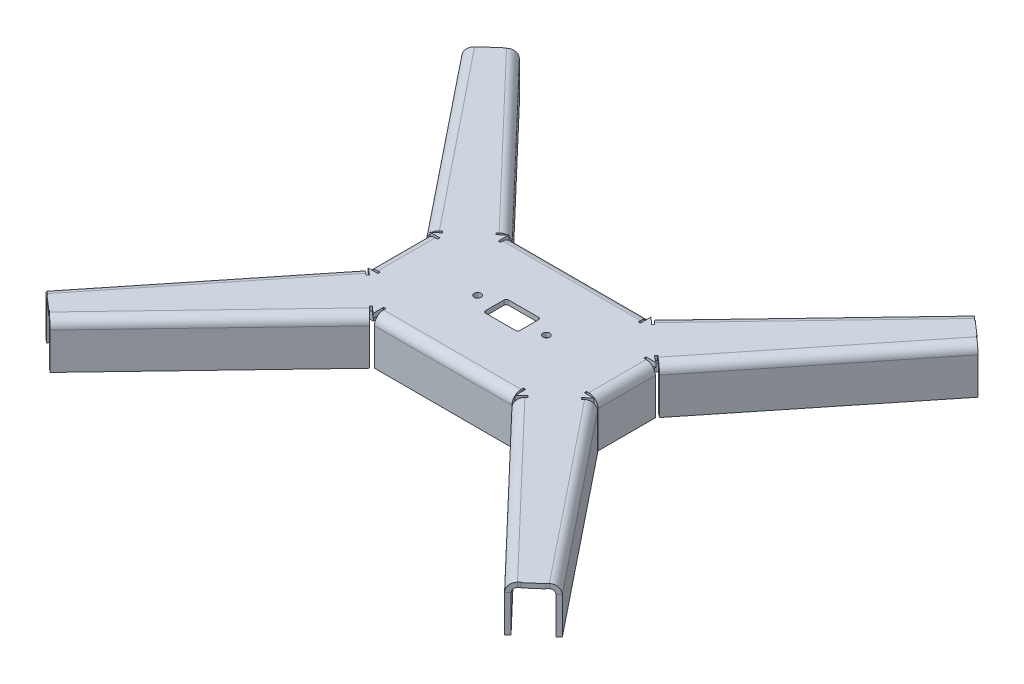
from build123d import *

# Parameters (mm, degrees)
BASE_FLANGE1_DEPTH             = 2
EDGE_FLANGE1_STRIP_W           = 12
EDGE_FLANGE1_STRIP_H           = 2
EDGE_FLANGE1_STRIP_CUT_DEPTH   = 60
EDGE_FLANGE1_RELIEF_W          = 13
EDGE_FLANGE1_RELIEF_H          = 1
EDGE_FLANGE1_RELIEF_CUT_DEPTH  = 2
EDGE_FLANGE1_DEPTH             = 60
EDGE_FLANGE2_STRIP_W           = 12
EDGE_FLANGE2_STRIP_H           = 2
EDGE_FLANGE2_STRIP_CUT_DEPTH   = 60
EDGE_FLANGE2_RELIEF_W          = 13
EDGE_FLANGE2_RELIEF_H          = 1
EDGE_FLANGE2_RELIEF_CUT_DEPTH  = 2
EDGE_FLANGE2_DEPTH             = 60
EDGE_FLANGE3_STRIP_W           = 12
EDGE_FLANGE3_STRIP_H           = 2
EDGE_FLANGE3_STRIP_CUT_DEPTH   = 25
EDGE_FLANGE3_RELIEF_W          = 13
EDGE_FLANGE3_RELIEF_H          = 1
EDGE_FLANGE3_RELIEF_CUT_DEPTH  = 2
EDGE_FLANGE3_DEPTH             = 25
EDGE_FLANGE4_STRIP_W           = 12
EDGE_FLANGE4_STRIP_H           = 2
EDGE_FLANGE4_STRIP_CUT_DEPTH   = 25
EDGE_FLANGE4_RELIEF_W          = 13
EDGE_FLANGE4_RELIEF_H          = 1
EDGE_FLANGE4_RELIEF_CUT_DEPTH  = 2
EDGE_FLANGE4_DEPTH             = 25
EDGE_FLANGE5_STRIP_W           = 12
EDGE_FLANGE5_STRIP_H           = 2
EDGE_FLANGE5_STRIP_CUT_DEPTH   = 98.814176372
EDGE_FLANGE5_RELIEF_W          = 13
EDGE_FLANGE5_RELIEF_H          = 1
EDGE_FLANGE5_RELIEF_CUT_DEPTH  = 2
EDGE_FLANGE5_DEPTH             = 98.814176372
EDGE_FLANGE6_STRIP_W           = 12
EDGE_FLANGE6_STRIP_H           = 2
EDGE_FLANGE6_STRIP_CUT_DEPTH   = 98.647471987
EDGE_FLANGE6_RELIEF_W          = 13
EDGE_FLANGE6_RELIEF_H          = 1
EDGE_FLANGE6_RELIEF_CUT_DEPTH  = 2
EDGE_FLANGE6_DEPTH             = 98.647471987
EDGE_FLANGE8_STRIP_W           = 12
EDGE_FLANGE8_STRIP_H           = 2
EDGE_FLANGE8_STRIP_CUT_DEPTH   = 98.814176372
EDGE_FLANGE8_RELIEF_W          = 13
EDGE_FLANGE8_RELIEF_H          = 1
EDGE_FLANGE8_RELIEF_CUT_DEPTH  = 2
EDGE_FLANGE8_DEPTH             = 98.814176372
EDGE_FLANGE9_STRIP_W           = 12
EDGE_FLANGE9_STRIP_H           = 2
EDGE_FLANGE9_STRIP_CUT_DEPTH   = 98.647471987
EDGE_FLANGE9_RELIEF_W          = 13
EDGE_FLANGE9_RELIEF_H          = 1
EDGE_FLANGE9_RELIEF_CUT_DEPTH  = 2
EDGE_FLANGE9_DEPTH             = 98.647471987
EDGE_FLANGE10_STRIP_W          = 12
EDGE_FLANGE10_STRIP_H          = 2
EDGE_FLANGE10_STRIP_CUT_DEPTH  = 98.647471987
EDGE_FLANGE10_RELIEF_W         = 13
EDGE_FLANGE10_RELIEF_H         = 1
EDGE_FLANGE10_RELIEF_CUT_DEPTH = 2
EDGE_FLANGE10_DEPTH            = 98.647471987
EDGE_FLANGE11_STRIP_W          = 12
EDGE_FLANGE11_STRIP_H          = 2
EDGE_FLANGE11_STRIP_CUT_DEPTH  = 98.814176372
EDGE_FLANGE11_RELIEF_W         = 13
EDGE_FLANGE11_RELIEF_H         = 1
EDGE_FLANGE11_RELIEF_CUT_DEPTH = 2
EDGE_FLANGE11_DEPTH            = 98.814176372
EDGE_FLANGE12_STRIP_W          = 12
EDGE_FLANGE12_STRIP_H          = 2
EDGE_FLANGE12_STRIP_CUT_DEPTH  = 98.814176372
EDGE_FLANGE12_RELIEF_W         = 13
EDGE_FLANGE12_RELIEF_H         = 1
EDGE_FLANGE12_RELIEF_CUT_DEPTH = 2
EDGE_FLANGE12_DEPTH            = 98.814176372
EDGE_FLANGE13_STRIP_W          = 12
EDGE_FLANGE13_STRIP_H          = 2
EDGE_FLANGE13_STRIP_CUT_DEPTH  = 98.647471987
EDGE_FLANGE13_RELIEF_W         = 13
EDGE_FLANGE13_RELIEF_H         = 1
EDGE_FLANGE13_RELIEF_CUT_DEPTH = 2
EDGE_FLANGE13_DEPTH            = 98.647471987
SKETCH58_R                     = 1.5
CUT_EXTRUDE2_DEPTH             = 154.469834479
SKETCH59_W                     = 15
SKETCH59_H                     = 10
CUT_EXTRUDE3_DEPTH             = 154.222028753
FILLET1_R                      = 1


# Sheet-metal steps are written as plain solids
with BuildPart() as part:
    # Sketch1 → Base-Flange1 (new body)
    with BuildSketch(Plane(origin=(0, 0, 0), x_dir=(1, 0, 0), z_dir=(0, 1, 0))):
        Polygon((-30, 30), (30, 30), (99.136281597, 102.382576262), (112.564639977, 90.63276268), (50, 12.5), (50, -12.5), (112.564639977, -90.63276268), (99.136281597, -102.382576262), (30, -30), (-30, -30), (-99.136281597, -102.382576262), (-112.564639977, -90.63276268), (-50, -12.5), (-50, 12.5), (-112.564639977, 90.63276268), (-99.136281597, 102.382576262), align=None)
    extrude(amount=-BASE_FLANGE1_DEPTH)

    # Edge-Flange1 strip (across the edge) → Edge-Flange1 strip cut (cut)
    with BuildSketch(Plane(origin=(30, -2, 30), x_dir=(0, 0, -1), z_dir=(-1, 0, 0))):
        with Locations((-2, -1)):
            Rectangle(EDGE_FLANGE1_STRIP_W, EDGE_FLANGE1_STRIP_H)
    extrude(amount=EDGE_FLANGE1_STRIP_CUT_DEPTH, mode=Mode.SUBTRACT)

    # Edge-Flange1 relief (on the sheet) → Edge-Flange1 relief cut (cut)
    with BuildSketch(Plane(origin=(30, -2, 26), x_dir=(0, 0, -1), z_dir=(0, -1, 0))):
        with Locations((-5.5, 0.5)):
            Rectangle(EDGE_FLANGE1_RELIEF_W, EDGE_FLANGE1_RELIEF_H)
        with Locations((-5.5, -60.5)):
            Rectangle(EDGE_FLANGE1_RELIEF_W, EDGE_FLANGE1_RELIEF_H)
    extrude(amount=-EDGE_FLANGE1_RELIEF_CUT_DEPTH, mode=Mode.SUBTRACT)

    # Edge-Flange1 section (across the edge) → Edge-Flange1 (add)
    with BuildSketch(Plane(origin=(30, -2, 30), x_dir=(0, 0, -1), z_dir=(-1, 0, 0))):
        with BuildLine():
            Line((0, 2), (0, 18))
            Line((0, 18), (2, 18))
            Line((2, 18), (2, 2))
            ThreePointArc((2, 2), (2.585786438, 0.585786438), (4, 0))
            Line((4, 0), (4, -2))
            ThreePointArc((4, -2), (1.171572875, -0.828427125), (0, 2))
        make_face()
    extrude(amount=EDGE_FLANGE1_DEPTH)

    # Edge-Flange2 strip (across the edge) → Edge-Flange2 strip cut (cut)
    with BuildSketch(Plane(origin=(-30, -2, -30), x_dir=(0, 0, 1), z_dir=(1, 0, 0))):
        with Locations((-2, -1)):
            Rectangle(EDGE_FLANGE2_STRIP_W, EDGE_FLANGE2_STRIP_H)
    extrude(amount=EDGE_FLANGE2_STRIP_CUT_DEPTH, mode=Mode.SUBTRACT)

    # Edge-Flange2 relief (on the sheet) → Edge-Flange2 relief cut (cut)
    with BuildSketch(Plane(origin=(-30, -2, -26), x_dir=(0, 0, 1), z_dir=(0, -1, 0))):
        with Locations((-5.5, 0.5)):
            Rectangle(EDGE_FLANGE2_RELIEF_W, EDGE_FLANGE2_RELIEF_H)
        with Locations((-5.5, -60.5)):
            Rectangle(EDGE_FLANGE2_RELIEF_W, EDGE_FLANGE2_RELIEF_H)
    extrude(amount=-EDGE_FLANGE2_RELIEF_CUT_DEPTH, mode=Mode.SUBTRACT)

    # Edge-Flange2 section (across the edge) → Edge-Flange2 (add)
    with BuildSketch(Plane(origin=(-30, -2, -30), x_dir=(0, 0, 1), z_dir=(1, 0, 0))):
        with BuildLine():
            Line((0, 2), (0, 18))
            Line((0, 18), (2, 18))
            Line((2, 18), (2, 2))
            ThreePointArc((2, 2), (2.585786438, 0.585786438), (4, 0))
            Line((4, 0), (4, -2))
            ThreePointArc((4, -2), (1.171572875, -0.828427125), (0, 2))
        make_face()
    extrude(amount=EDGE_FLANGE2_DEPTH)

    # Edge-Flange3 strip (across the edge) → Edge-Flange3 strip cut (cut)
    with BuildSketch(Plane(origin=(50, -2, -12.5), x_dir=(-1, 0, 0), z_dir=(0, 0, 1))):
        with Locations((-2, -1)):
            Rectangle(EDGE_FLANGE3_STRIP_W, EDGE_FLANGE3_STRIP_H)
    extrude(amount=EDGE_FLANGE3_STRIP_CUT_DEPTH, mode=Mode.SUBTRACT)

    # Edge-Flange3 relief (on the sheet) → Edge-Flange3 relief cut (cut)
    with BuildSketch(Plane(origin=(46, -2, -12.5), x_dir=(-1, 0, 0), z_dir=(0, -1, 0))):
        with Locations((-5.5, 0.5)):
            Rectangle(EDGE_FLANGE3_RELIEF_W, EDGE_FLANGE3_RELIEF_H)
        with Locations((-5.5, -25.5)):
            Rectangle(EDGE_FLANGE3_RELIEF_W, EDGE_FLANGE3_RELIEF_H)
    extrude(amount=-EDGE_FLANGE3_RELIEF_CUT_DEPTH, mode=Mode.SUBTRACT)

    # Edge-Flange3 section (across the edge) → Edge-Flange3 (add)
    with BuildSketch(Plane(origin=(50, -2, -12.5), x_dir=(-1, 0, 0), z_dir=(0, 0, 1))):
        with BuildLine():
            Line((0, 2), (0, 18))
            Line((0, 18), (2, 18))
            Line((2, 18), (2, 2))
            ThreePointArc((2, 2), (2.585786438, 0.585786438), (4, 0))
            Line((4, 0), (4, -2))
            ThreePointArc((4, -2), (1.171572875, -0.828427125), (0, 2))
        make_face()
    extrude(amount=EDGE_FLANGE3_DEPTH)

    # Edge-Flange4 strip (across the edge) → Edge-Flange4 strip cut (cut)
    with BuildSketch(Plane(origin=(-50, -2, 12.5), x_dir=(1, 0, 0), z_dir=(0, 0, -1))):
        with Locations((-2, -1)):
            Rectangle(EDGE_FLANGE4_STRIP_W, EDGE_FLANGE4_STRIP_H)
    extrude(amount=EDGE_FLANGE4_STRIP_CUT_DEPTH, mode=Mode.SUBTRACT)

    # Edge-Flange4 relief (on the sheet) → Edge-Flange4 relief cut (cut)
    with BuildSketch(Plane(origin=(-46, -2, 12.5), x_dir=(1, 0, 0), z_dir=(0, -1, 0))):
        with Locations((-5.5, 0.5)):
            Rectangle(EDGE_FLANGE4_RELIEF_W, EDGE_FLANGE4_RELIEF_H)
        with Locations((-5.5, -25.5)):
            Rectangle(EDGE_FLANGE4_RELIEF_W, EDGE_FLANGE4_RELIEF_H)
    extrude(amount=-EDGE_FLANGE4_RELIEF_CUT_DEPTH, mode=Mode.SUBTRACT)

    # Edge-Flange4 section (across the edge) → Edge-Flange4 (add)
    with BuildSketch(Plane(origin=(-50, -2, 12.5), x_dir=(1, 0, 0), z_dir=(0, 0, -1))):
        with BuildLine():
            Line((0, 2), (0, 18))
            Line((0, 18), (2, 18))
            Line((2, 18), (2, 2))
            ThreePointArc((2, 2), (2.585786438, 0.585786438), (4, 0))
            Line((4, 0), (4, -2))
            ThreePointArc((4, -2), (1.171572875, -0.828427125), (0, 2))
        make_face()
    extrude(amount=EDGE_FLANGE4_DEPTH)

    # Edge-Flange5 strip (across the edge) → Edge-Flange5 strip cut (cut)
    with BuildSketch(Plane(origin=(50.800747828, -2, 13.5), x_dir=(-0.7805839760233348, -3.4914813388431337e-15, 0.6250509230259579), z_dir=(0.6250509230259579, 0, 0.7805839760233348))):
        with Locations((-2, -1)):
            Rectangle(EDGE_FLANGE5_STRIP_W, EDGE_FLANGE5_STRIP_H)
    extrude(amount=EDGE_FLANGE5_STRIP_CUT_DEPTH, mode=Mode.SUBTRACT)

    # Edge-Flange5 relief (on the sheet) → Edge-Flange5 relief cut (cut)
    with BuildSketch(Plane(origin=(47.678411923, -2, 16.000203692), x_dir=(-0.7805839760233348, -6.982962677686267e-15, 0.6250509230259579), z_dir=(0, -1, 0))):
        with Locations((-5.5, 0.5)):
            Rectangle(EDGE_FLANGE5_RELIEF_W, EDGE_FLANGE5_RELIEF_H)
        with Locations((-5.5, -99.314176372)):
            Rectangle(EDGE_FLANGE5_RELIEF_W, EDGE_FLANGE5_RELIEF_H)
    extrude(amount=-EDGE_FLANGE5_RELIEF_CUT_DEPTH, mode=Mode.SUBTRACT)

    # Edge-Flange5 section (across the edge) → Edge-Flange5 (add)
    with BuildSketch(Plane(origin=(50.800747828, -2, 13.5), x_dir=(-0.7805839760233348, -3.4914813388431337e-15, 0.6250509230259579), z_dir=(0.6250509230259579, 0, 0.7805839760233348))):
        with BuildLine():
            Line((0, 2), (0, 18))
            Line((0, 18), (2, 18))
            Line((2, 18), (2, 2))
            ThreePointArc((2, 2), (2.585786438, 0.585786438), (4, 0))
            Line((4, 0), (4, -2))
            ThreePointArc((4, -2), (1.171572875, -0.828427125), (0, 2))
        make_face()
    extrude(amount=EDGE_FLANGE5_DEPTH)

    # Edge-Flange6 strip (across the edge) → Edge-Flange6 strip cut (cut)
    with BuildSketch(Plane(origin=(99.136281597, -2, 102.382576262), x_dir=(0.7231368408783835, -3.491481338843134e-15, -0.6907047917630452), z_dir=(-0.6907047917630452, 0, -0.7231368408783835))):
        with Locations((-2, -1)):
            Rectangle(EDGE_FLANGE6_STRIP_W, EDGE_FLANGE6_STRIP_H)
    extrude(amount=EDGE_FLANGE6_STRIP_CUT_DEPTH, mode=Mode.SUBTRACT)

    # Edge-Flange6 relief (on the sheet) → Edge-Flange6 relief cut (cut)
    with BuildSketch(Plane(origin=(102.028828961, -2, 99.619757095), x_dir=(0.7231368408783835, -6.9829626776862675e-15, -0.6907047917630452), z_dir=(0, -1, 0))):
        with Locations((-5.5, 0.5)):
            Rectangle(EDGE_FLANGE6_RELIEF_W, EDGE_FLANGE6_RELIEF_H)
        with Locations((-5.5, -99.147471987)):
            Rectangle(EDGE_FLANGE6_RELIEF_W, EDGE_FLANGE6_RELIEF_H)
    extrude(amount=-EDGE_FLANGE6_RELIEF_CUT_DEPTH, mode=Mode.SUBTRACT)

    # Edge-Flange6 section (across the edge) → Edge-Flange6 (add)
    with BuildSketch(Plane(origin=(99.136281597, -2, 102.382576262), x_dir=(0.7231368408783835, -3.491481338843134e-15, -0.6907047917630452), z_dir=(-0.6907047917630452, 0, -0.7231368408783835))):
        with BuildLine():
            Line((0, 2), (0, 18))
            Line((0, 18), (2, 18))
            Line((2, 18), (2, 2))
            ThreePointArc((2, 2), (2.585786438, 0.585786438), (4, 0))
            Line((4, 0), (4, -2))
            ThreePointArc((4, -2), (1.171572875, -0.828427125), (0, 2))
        make_face()
    extrude(amount=EDGE_FLANGE6_DEPTH)

    # Edge-Flange8 strip (across the edge) → Edge-Flange8 strip cut (cut)
    with BuildSketch(Plane(origin=(112.564639977, -2, -90.63276268), x_dir=(-0.7805839760233348, -3.4914813388431337e-15, -0.6250509230259579), z_dir=(-0.6250509230259579, 0, 0.7805839760233348))):
        with Locations((-2, -1)):
            Rectangle(EDGE_FLANGE8_STRIP_W, EDGE_FLANGE8_STRIP_H)
    extrude(amount=EDGE_FLANGE8_STRIP_CUT_DEPTH, mode=Mode.SUBTRACT)

    # Edge-Flange8 relief (on the sheet) → Edge-Flange8 relief cut (cut)
    with BuildSketch(Plane(origin=(109.442304073, -2, -93.132966372), x_dir=(-0.7805839760233348, -6.982962677686267e-15, -0.6250509230259579), z_dir=(0, -1, 0))):
        with Locations((-5.5, 0.5)):
            Rectangle(EDGE_FLANGE8_RELIEF_W, EDGE_FLANGE8_RELIEF_H)
        with Locations((-5.5, -99.314176372)):
            Rectangle(EDGE_FLANGE8_RELIEF_W, EDGE_FLANGE8_RELIEF_H)
    extrude(amount=-EDGE_FLANGE8_RELIEF_CUT_DEPTH, mode=Mode.SUBTRACT)

    # Edge-Flange8 section (across the edge) → Edge-Flange8 (add)
    with BuildSketch(Plane(origin=(112.564639977, -2, -90.63276268), x_dir=(-0.7805839760233348, -3.4914813388431337e-15, -0.6250509230259579), z_dir=(-0.6250509230259579, 0, 0.7805839760233348))):
        with BuildLine():
            Line((0, 2), (0, 18))
            Line((0, 18), (2, 18))
            Line((2, 18), (2, 2))
            ThreePointArc((2, 2), (2.585786438, 0.585786438), (4, 0))
            Line((4, 0), (4, -2))
            ThreePointArc((4, -2), (1.171572875, -0.828427125), (0, 2))
        make_face()
    extrude(amount=EDGE_FLANGE8_DEPTH)

    # Edge-Flange9 strip (across the edge) → Edge-Flange9 strip cut (cut)
    with BuildSketch(Plane(origin=(31, -2, -31.046955008), x_dir=(0.7231368408783835, -3.4914813388431337e-15, 0.6907047917630452), z_dir=(0.6907047917630452, 0, -0.7231368408783835))):
        with Locations((-2, -1)):
            Rectangle(EDGE_FLANGE9_STRIP_W, EDGE_FLANGE9_STRIP_H)
    extrude(amount=EDGE_FLANGE9_STRIP_CUT_DEPTH, mode=Mode.SUBTRACT)

    # Edge-Flange9 relief (on the sheet) → Edge-Flange9 relief cut (cut)
    with BuildSketch(Plane(origin=(33.892547364, -2, -28.284135841), x_dir=(0.7231368408783835, -6.982962677686267e-15, 0.6907047917630452), z_dir=(0, -1, 0))):
        with Locations((-5.5, 0.5)):
            Rectangle(EDGE_FLANGE9_RELIEF_W, EDGE_FLANGE9_RELIEF_H)
        with Locations((-5.5, -99.147471987)):
            Rectangle(EDGE_FLANGE9_RELIEF_W, EDGE_FLANGE9_RELIEF_H)
    extrude(amount=-EDGE_FLANGE9_RELIEF_CUT_DEPTH, mode=Mode.SUBTRACT)

    # Edge-Flange9 section (across the edge) → Edge-Flange9 (add)
    with BuildSketch(Plane(origin=(31, -2, -31.046955008), x_dir=(0.7231368408783835, -3.4914813388431337e-15, 0.6907047917630452), z_dir=(0.6907047917630452, 0, -0.7231368408783835))):
        with BuildLine():
            Line((0, 2), (0, 18))
            Line((0, 18), (2, 18))
            Line((2, 18), (2, 2))
            ThreePointArc((2, 2), (2.585786438, 0.585786438), (4, 0))
            Line((4, 0), (4, -2))
            ThreePointArc((4, -2), (1.171572875, -0.828427125), (0, 2))
        make_face()
    extrude(amount=EDGE_FLANGE9_DEPTH)

    # Edge-Flange10 strip (across the edge) → Edge-Flange10 strip cut (cut)
    with BuildSketch(Plane(origin=(-99.136281597, -2, -102.382576262), x_dir=(-0.7231368408783835, -3.4914813388431337e-15, 0.6907047917630452), z_dir=(0.6907047917630452, 0, 0.7231368408783835))):
        with Locations((-2, -1)):
            Rectangle(EDGE_FLANGE10_STRIP_W, EDGE_FLANGE10_STRIP_H)
    extrude(amount=EDGE_FLANGE10_STRIP_CUT_DEPTH, mode=Mode.SUBTRACT)

    # Edge-Flange10 relief (on the sheet) → Edge-Flange10 relief cut (cut)
    with BuildSketch(Plane(origin=(-102.028828961, -2, -99.619757095), x_dir=(-0.7231368408783835, -6.982962677686267e-15, 0.6907047917630452), z_dir=(0, -1, 0))):
        with Locations((-5.5, 0.5)):
            Rectangle(EDGE_FLANGE10_RELIEF_W, EDGE_FLANGE10_RELIEF_H)
        with Locations((-5.5, -99.147471987)):
            Rectangle(EDGE_FLANGE10_RELIEF_W, EDGE_FLANGE10_RELIEF_H)
    extrude(amount=-EDGE_FLANGE10_RELIEF_CUT_DEPTH, mode=Mode.SUBTRACT)

    # Edge-Flange10 section (across the edge) → Edge-Flange10 (add)
    with BuildSketch(Plane(origin=(-99.136281597, -2, -102.382576262), x_dir=(-0.7231368408783835, -3.4914813388431337e-15, 0.6907047917630452), z_dir=(0.6907047917630452, 0, 0.7231368408783835))):
        with BuildLine():
            Line((0, 2), (0, 18))
            Line((0, 18), (2, 18))
            Line((2, 18), (2, 2))
            ThreePointArc((2, 2), (2.585786438, 0.585786438), (4, 0))
            Line((4, 0), (4, -2))
            ThreePointArc((4, -2), (1.171572875, -0.828427125), (0, 2))
        make_face()
    extrude(amount=EDGE_FLANGE10_DEPTH)

    # Edge-Flange11 strip (across the edge) → Edge-Flange11 strip cut (cut)
    with BuildSketch(Plane(origin=(-50.800747828, -2, -13.5), x_dir=(0.7805839760233348, -3.4914813388431337e-15, -0.6250509230259579), z_dir=(-0.6250509230259579, 0, -0.7805839760233348))):
        with Locations((-2, -1)):
            Rectangle(EDGE_FLANGE11_STRIP_W, EDGE_FLANGE11_STRIP_H)
    extrude(amount=EDGE_FLANGE11_STRIP_CUT_DEPTH, mode=Mode.SUBTRACT)

    # Edge-Flange11 relief (on the sheet) → Edge-Flange11 relief cut (cut)
    with BuildSketch(Plane(origin=(-47.678411923, -2, -16.000203692), x_dir=(0.7805839760233348, -6.982962677686267e-15, -0.6250509230259579), z_dir=(0, -1, 0))):
        with Locations((-5.5, 0.5)):
            Rectangle(EDGE_FLANGE11_RELIEF_W, EDGE_FLANGE11_RELIEF_H)
        with Locations((-5.5, -99.314176372)):
            Rectangle(EDGE_FLANGE11_RELIEF_W, EDGE_FLANGE11_RELIEF_H)
    extrude(amount=-EDGE_FLANGE11_RELIEF_CUT_DEPTH, mode=Mode.SUBTRACT)

    # Edge-Flange11 section (across the edge) → Edge-Flange11 (add)
    with BuildSketch(Plane(origin=(-50.800747828, -2, -13.5), x_dir=(0.7805839760233348, -3.4914813388431337e-15, -0.6250509230259579), z_dir=(-0.6250509230259579, 0, -0.7805839760233348))):
        with BuildLine():
            Line((0, 2), (0, 18))
            Line((0, 18), (2, 18))
            Line((2, 18), (2, 2))
            ThreePointArc((2, 2), (2.585786438, 0.585786438), (4, 0))
            Line((4, 0), (4, -2))
            ThreePointArc((4, -2), (1.171572875, -0.828427125), (0, 2))
        make_face()
    extrude(amount=EDGE_FLANGE11_DEPTH)

    # Edge-Flange12 strip (across the edge) → Edge-Flange12 strip cut (cut)
    with BuildSketch(Plane(origin=(-112.564639977, -2, 90.63276268), x_dir=(0.7805839760233348, -3.4914813388431337e-15, 0.6250509230259579), z_dir=(0.6250509230259579, 0, -0.7805839760233348))):
        with Locations((-2, -1)):
            Rectangle(EDGE_FLANGE12_STRIP_W, EDGE_FLANGE12_STRIP_H)
    extrude(amount=EDGE_FLANGE12_STRIP_CUT_DEPTH, mode=Mode.SUBTRACT)

    # Edge-Flange12 relief (on the sheet) → Edge-Flange12 relief cut (cut)
    with BuildSketch(Plane(origin=(-109.442304073, -2, 93.132966372), x_dir=(0.7805839760233348, -6.982962677686267e-15, 0.6250509230259579), z_dir=(0, -1, 0))):
        with Locations((-5.5, 0.5)):
            Rectangle(EDGE_FLANGE12_RELIEF_W, EDGE_FLANGE12_RELIEF_H)
        with Locations((-5.5, -99.314176372)):
            Rectangle(EDGE_FLANGE12_RELIEF_W, EDGE_FLANGE12_RELIEF_H)
    extrude(amount=-EDGE_FLANGE12_RELIEF_CUT_DEPTH, mode=Mode.SUBTRACT)

    # Edge-Flange12 section (across the edge) → Edge-Flange12 (add)
    with BuildSketch(Plane(origin=(-112.564639977, -2, 90.63276268), x_dir=(0.7805839760233348, -3.4914813388431337e-15, 0.6250509230259579), z_dir=(0.6250509230259579, 0, -0.7805839760233348))):
        with BuildLine():
            Line((0, 2), (0, 18))
            Line((0, 18), (2, 18))
            Line((2, 18), (2, 2))
            ThreePointArc((2, 2), (2.585786438, 0.585786438), (4, 0))
            Line((4, 0), (4, -2))
            ThreePointArc((4, -2), (1.171572875, -0.828427125), (0, 2))
        make_face()
    extrude(amount=EDGE_FLANGE12_DEPTH)

    # Edge-Flange13 strip (across the edge) → Edge-Flange13 strip cut (cut)
    with BuildSketch(Plane(origin=(-31, -2, 31.046955008), x_dir=(-0.7231368408783835, -3.491481338843134e-15, -0.6907047917630452), z_dir=(-0.6907047917630452, 0, 0.7231368408783835))):
        with Locations((-2, -1)):
            Rectangle(EDGE_FLANGE13_STRIP_W, EDGE_FLANGE13_STRIP_H)
    extrude(amount=EDGE_FLANGE13_STRIP_CUT_DEPTH, mode=Mode.SUBTRACT)

    # Edge-Flange13 relief (on the sheet) → Edge-Flange13 relief cut (cut)
    with BuildSketch(Plane(origin=(-33.892547364, -2, 28.284135841), x_dir=(-0.7231368408783835, -6.9829626776862675e-15, -0.6907047917630452), z_dir=(0, -1, 0))):
        with Locations((-5.5, 0.5)):
            Rectangle(EDGE_FLANGE13_RELIEF_W, EDGE_FLANGE13_RELIEF_H)
        with Locations((-5.5, -99.147471987)):
            Rectangle(EDGE_FLANGE13_RELIEF_W, EDGE_FLANGE13_RELIEF_H)
    extrude(amount=-EDGE_FLANGE13_RELIEF_CUT_DEPTH, mode=Mode.SUBTRACT)

    # Edge-Flange13 section (across the edge) → Edge-Flange13 (add)
    with BuildSketch(Plane(origin=(-31, -2, 31.046955008), x_dir=(-0.7231368408783835, -3.491481338843134e-15, -0.6907047917630452), z_dir=(-0.6907047917630452, 0, 0.7231368408783835))):
        with BuildLine():
            Line((0, 2), (0, 18))
            Line((0, 18), (2, 18))
            Line((2, 18), (2, 2))
            ThreePointArc((2, 2), (2.585786438, 0.585786438), (4, 0))
            Line((4, 0), (4, -2))
            ThreePointArc((4, -2), (1.171572875, -0.828427125), (0, 2))
        make_face()
    extrude(amount=EDGE_FLANGE13_DEPTH)

    # Sketch58 → Cut-Extrude2 (cut, through all)
    with BuildSketch(Plane(origin=(0, 0, 0), x_dir=(1, 0, 0), z_dir=(0, 1, 0))):
        with Locations(Location((-15, 0, 0), (0, 0, 270))):
            Circle(SKETCH58_R)
        with Locations(Location((15, 0, 0), (0, 0, 270))):
            Circle(SKETCH58_R)
    extrude(amount=-CUT_EXTRUDE2_DEPTH, mode=Mode.SUBTRACT)

    # Sketch59 → Cut-Extrude3 (cut, through all)
    with BuildSketch(Plane.XZ.offset(2)):
        Rectangle(SKETCH59_W, SKETCH59_H)
    extrude(amount=-CUT_EXTRUDE3_DEPTH, mode=Mode.SUBTRACT)

    # Fillet1
    fillet1_edges = [part.edges().sort_by_distance(p)[0] for p in [
        (7.5, -1, 5),
        (7.5, -1, -5),
        (-7.5, -1, -5),
        (-7.5, -1, 5),
    ]]
    fillet(fillet1_edges, radius=FILLET1_R)


solid = part.part
